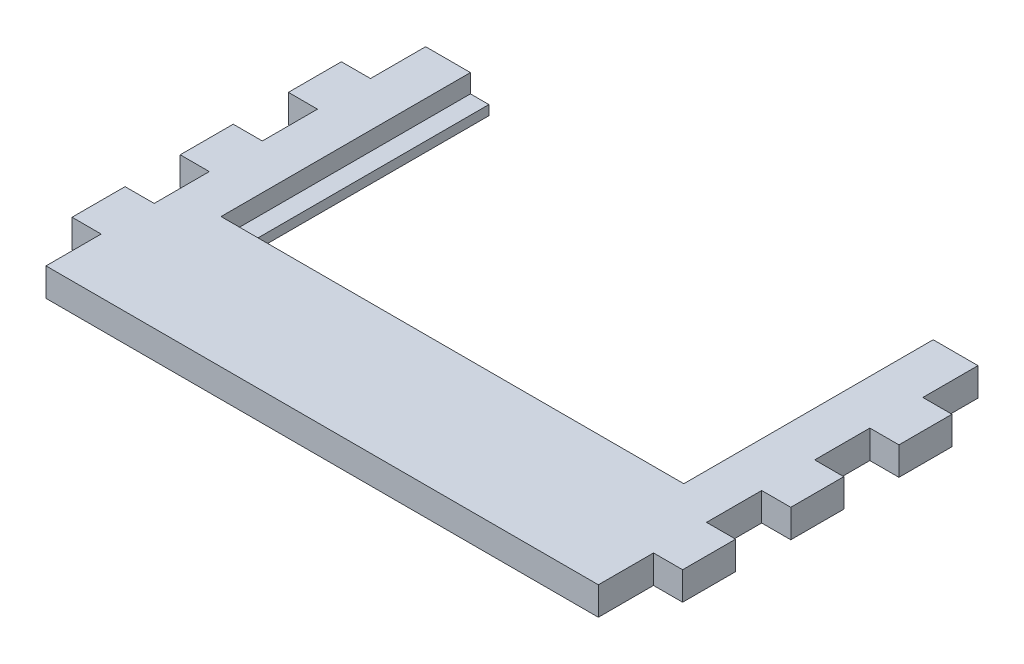
from build123d import *

# Parameters (mm, degrees)
BOSS_EXTRU_1_DEPTH      = 15.25
ESQUISSE2_W             = 250.5
ESQUISSE2_H             = 135
ENL_V_MAT_EXTRU_1_DEPTH = 10
ENL_V_MAT_EXTRU_2_REACH = 252.203
ESQUISSE3_W             = 15.75
ESQUISSE3_H             = 29.857142857
ESQUISSE3_H_2           = 29.857142858


with BuildPart() as part:
    # Esquisse1 → Boss.-Extru.1 (new body)
    with BuildSketch(Plane(origin=(0, 0, 0), x_dir=(1, 0, 0), z_dir=(0, 1, 0))):
        Polygon((-113.085152838, 185.313864629), (-163.085152838, 185.313864629), (-163.085152838, -20.186135371), (167.414847162, -20.186135371), (167.414847162, 185.313864629), (117.414847162, 185.313864629), (117.414847162, 60.313864629), (-113.085152838, 60.313864629), align=None)
    extrude(amount=BOSS_EXTRU_1_DEPTH)

    # Esquisse2 → Enlèv. mat.-Extru.1 (cut)
    with BuildSketch(Plane(origin=(0, 15.25, 0), x_dir=(1, 0, 0), z_dir=(0, 1, 0))):
        with Locations((2.164847162, 117.813864629)):
            Rectangle(ESQUISSE2_W, ESQUISSE2_H)
    extrude(amount=-ENL_V_MAT_EXTRU_1_DEPTH, mode=Mode.SUBTRACT)

    # Esquisse3 → Enlèv. mat.-Extru.2 (cut, up to next)
    with BuildSketch(Plane(origin=(0, 15.25, 0), x_dir=(1, 0, 0), z_dir=(0, 1, 0)), mode=Mode.PRIVATE) as enl_v_mat_extru_2_sk1:
        with Locations((-155.210152838, 170.385293201)):
            Rectangle(ESQUISSE3_W, ESQUISSE3_H)
    enl_v_mat_extru_2_tool1 = extrude(enl_v_mat_extru_2_sk1.sketch, amount=-ENL_V_MAT_EXTRU_2_REACH, mode=Mode.PRIVATE) & part.part
    # Esquisse3 → Enlèv. mat.-Extru.2 (cut, up to next)
    with BuildSketch(Plane(origin=(0, 15.25, 0), x_dir=(1, 0, 0), z_dir=(0, 1, 0)), mode=Mode.PRIVATE) as enl_v_mat_extru_2_sk2:
        with Locations((-155.210152838, 111.837674152)):
            Rectangle(ESQUISSE3_W, ESQUISSE3_H)
    enl_v_mat_extru_2_tool2 = extrude(enl_v_mat_extru_2_sk2.sketch, amount=-ENL_V_MAT_EXTRU_2_REACH, mode=Mode.PRIVATE) & part.part
    # Esquisse3 → Enlèv. mat.-Extru.2 (cut, up to next)
    with BuildSketch(Plane(origin=(0, 15.25, 0), x_dir=(1, 0, 0), z_dir=(0, 1, 0)), mode=Mode.PRIVATE) as enl_v_mat_extru_2_sk3:
        with Locations((-155.210152838, 53.290055105)):
            Rectangle(ESQUISSE3_W, ESQUISSE3_H_2)
    enl_v_mat_extru_2_tool3 = extrude(enl_v_mat_extru_2_sk3.sketch, amount=-ENL_V_MAT_EXTRU_2_REACH, mode=Mode.PRIVATE) & part.part
    # Esquisse3 → Enlèv. mat.-Extru.2 (cut, up to next)
    with BuildSketch(Plane(origin=(0, 15.25, 0), x_dir=(1, 0, 0), z_dir=(0, 1, 0)), mode=Mode.PRIVATE) as enl_v_mat_extru_2_sk4:
        with Locations((-155.210152838, -5.257563943)):
            Rectangle(ESQUISSE3_W, ESQUISSE3_H)
    enl_v_mat_extru_2_tool4 = extrude(enl_v_mat_extru_2_sk4.sketch, amount=-ENL_V_MAT_EXTRU_2_REACH, mode=Mode.PRIVATE) & part.part
    enl_v_mat_extru_2_1 = enl_v_mat_extru_2_tool1.solids().sort_by_distance((-155.210153, 15.25, -170.385293))[0]
    add(enl_v_mat_extru_2_1, mode=Mode.SUBTRACT)
    enl_v_mat_extru_2_2 = enl_v_mat_extru_2_tool2.solids().sort_by_distance((-155.210153, 15.25, -111.837674))[0]
    add(enl_v_mat_extru_2_2, mode=Mode.SUBTRACT)
    enl_v_mat_extru_2_3 = enl_v_mat_extru_2_tool3.solids().sort_by_distance((-155.210153, 15.25, -53.290055))[0]
    add(enl_v_mat_extru_2_3, mode=Mode.SUBTRACT)
    enl_v_mat_extru_2_4 = enl_v_mat_extru_2_tool4.solids().sort_by_distance((-155.210153, 15.25, 5.257564))[0]
    add(enl_v_mat_extru_2_4, mode=Mode.SUBTRACT)
    enl_v_mat_extru_2 = enl_v_mat_extru_2_1 + enl_v_mat_extru_2_2 + enl_v_mat_extru_2_3 + enl_v_mat_extru_2_4  # Enlèv. mat.-Extru.2 as one shape, for the pattern or mirror that repeats it

    # Symétrie1: Enlèv. mat.-Extru.2 across plane
    add(enl_v_mat_extru_2.mirror(Plane.ZY.offset(-2.164847162)), mode=Mode.SUBTRACT)


solid = part.part
